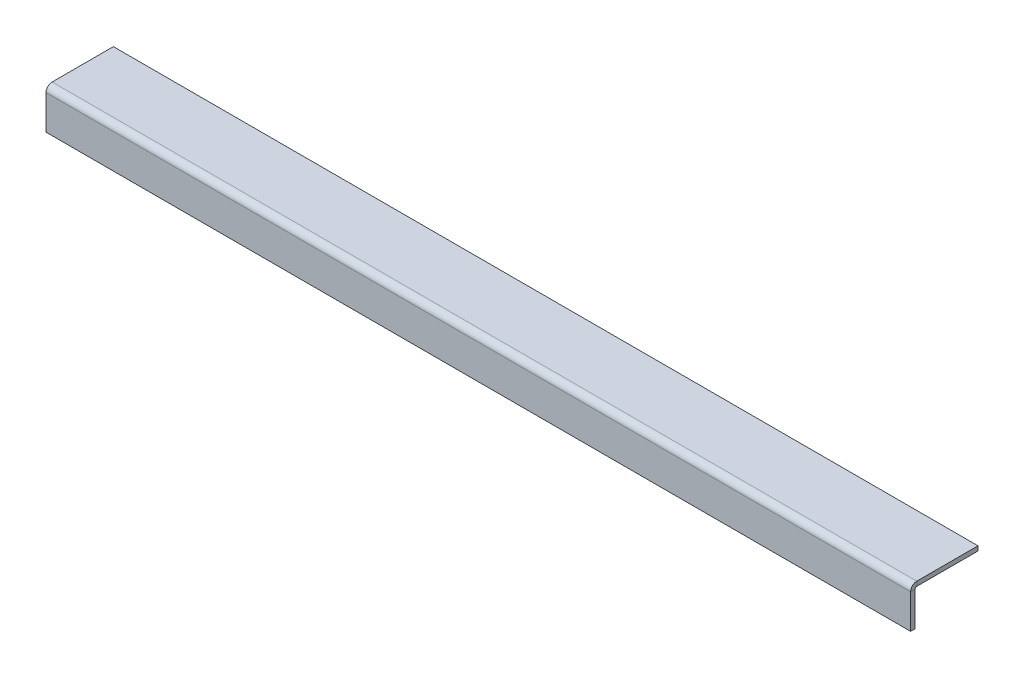
from build123d import *

# Parameters (mm, degrees)
SKETCH1_W                    = 385
SKETCH1_H                    = 30
BASE_FLANGE1_DEPTH           = 2
EDGE_FLANGE2_STRIP_W         = 9.4732
EDGE_FLANGE2_STRIP_H         = 2
EDGE_FLANGE2_STRIP_CUT_DEPTH = 385
EDGE_FLANGE2_DEPTH           = 385


# Sheet-metal steps are written as plain solids
with BuildPart() as part:
    # Sketch1 → Base-Flange1 (new body)
    with BuildSketch(Plane(origin=(0, 0, 0), x_dir=(1, 0, 0), z_dir=(0, 1, 0))):
        with Locations((0, 15)):
            Rectangle(SKETCH1_W, SKETCH1_H)
    extrude(amount=-BASE_FLANGE1_DEPTH)

    # Edge-Flange2 strip (across the edge) → Edge-Flange2 strip cut (cut)
    with BuildSketch(Plane(origin=(192.5, -2, 0), x_dir=(0, 0, -1), z_dir=(-1, 0, 0))):
        with Locations((-2, -1)):
            Rectangle(EDGE_FLANGE2_STRIP_W, EDGE_FLANGE2_STRIP_H)
    extrude(amount=EDGE_FLANGE2_STRIP_CUT_DEPTH, mode=Mode.SUBTRACT)

    # Edge-Flange2 section (across the edge) → Edge-Flange2 (add)
    with BuildSketch(Plane(origin=(192.5, -2, 0), x_dir=(0, 0, -1), z_dir=(-1, 0, 0))):
        with BuildLine():
            Line((0, 0.7366), (0, 16))
            Line((0, 16), (2, 16))
            Line((2, 16), (2, 0.7366))
            ThreePointArc((2, 0.7366), (2.215745145, 0.215745145), (2.7366, 0))
            Line((2.7366, 0), (2.7366, -2))
            ThreePointArc((2.7366, -2), (0.801531583, -1.198468417), (0, 0.7366))
        make_face()
    extrude(amount=EDGE_FLANGE2_DEPTH)


solid = part.part
